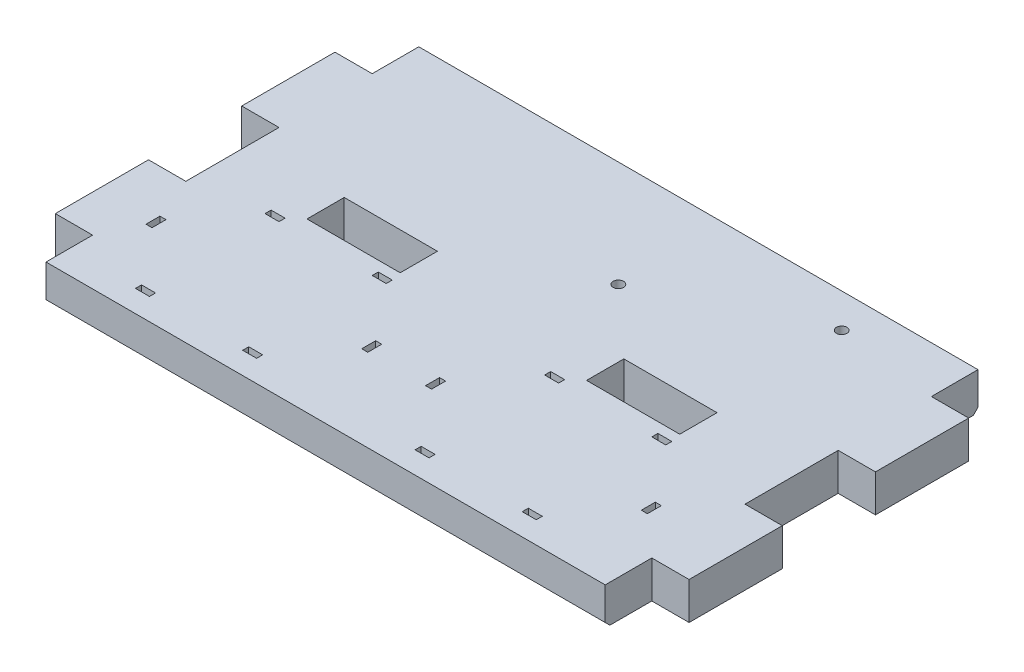
from build123d import *

# Parameters (mm, degrees)
SKETCH1_W           = 120
SKETCH1_H           = 80
SKETCH1_R           = 1.13
SKETCH1_W_2         = 3
SKETCH1_H_2         = 1.3
SKETCH1_W_3         = 1.3
SKETCH1_H_3         = 3
BOSS_EXTRUDE1_DEPTH = 8
CUT_EXTRUDE1_DEPTH  = 4
CHAMFER1_SIZE       = 1
CUT_EXTRUDE2_REACH  = 74.553
SKETCH3_W           = 20
SKETCH3_H           = 8
SKETCH4_W           = 20
SKETCH4_H           = 8
BOSS_EXTRUDE2_DEPTH = 8


with BuildPart() as part:
    # Sketch1 → Boss-Extrude1 (new body)
    with BuildSketch(Plane(origin=(0, 0, 0), x_dir=(1, 0, 0), z_dir=(0, 1, 0))):
        Rectangle(SKETCH1_W, SKETCH1_H)
        with Locations((38.07, 32.68)):
            Circle(SKETCH1_R, mode=Mode.SUBTRACT)
        with Locations((5.56, 17.26)):
            Circle(SKETCH1_R, mode=Mode.SUBTRACT)
        with Locations((16, -34.65)):
            Rectangle(SKETCH1_W_2, SKETCH1_H_2, mode=Mode.SUBTRACT)
        with Locations((16, -6.85)):
            Rectangle(SKETCH1_W_2, SKETCH1_H_2, mode=Mode.SUBTRACT)
        with Locations((39, -6.85)):
            Rectangle(SKETCH1_W_2, SKETCH1_H_2, mode=Mode.SUBTRACT)
        with Locations((39, -34.65)):
            Rectangle(SKETCH1_W_2, SKETCH1_H_2, mode=Mode.SUBTRACT)
        with Locations((50.65, -20.75)):
            Rectangle(SKETCH1_W_3, SKETCH1_H_3, mode=Mode.SUBTRACT)
        with Locations((4.35, -20.75)):
            Rectangle(SKETCH1_W_3, SKETCH1_H_3, mode=Mode.SUBTRACT)
        with Locations((-55.65, -20.75)):
            Rectangle(SKETCH1_W_3, SKETCH1_H_3, mode=Mode.SUBTRACT)
        with Locations((-9.35, -20.75)):
            Rectangle(SKETCH1_W_3, SKETCH1_H_3, mode=Mode.SUBTRACT)
        with Locations((-44, -34.65)):
            Rectangle(SKETCH1_W_2, SKETCH1_H_2, mode=Mode.SUBTRACT)
        with Locations((-44, -6.85)):
            Rectangle(SKETCH1_W_2, SKETCH1_H_2, mode=Mode.SUBTRACT)
        with Locations((-21, -34.65)):
            Rectangle(SKETCH1_W_2, SKETCH1_H_2, mode=Mode.SUBTRACT)
        with Locations((-21, -6.85)):
            Rectangle(SKETCH1_W_2, SKETCH1_H_2, mode=Mode.SUBTRACT)
    extrude(amount=BOSS_EXTRUDE1_DEPTH)

    # Sketch2 → Cut-Extrude1 (cut)
    with BuildSketch(Plane.XZ):
        Polygon((7.869401077, -17.26), (6.714700538, -15.26), (4.405299462, -15.26), (3.250598923, -17.26), (4.405299462, -19.26), (6.714700538, -19.26), align=None)
        Polygon((40.379401077, -32.68), (39.224700538, -30.68), (36.915299462, -30.68), (35.760598923, -32.68), (36.915299462, -34.68), (39.224700538, -34.68), align=None)
    extrude(amount=-CUT_EXTRUDE1_DEPTH, mode=Mode.SUBTRACT)

    # Chamfer1
    chamfer1_edges = [part.edges().sort_by_distance(p)[0] for p in [
        (0, 0, -40),
        (0, 0, 40),
    ]]
    chamfer(chamfer1_edges, length=CHAMFER1_SIZE)

    # Sketch3 → Cut-Extrude2 (cut, up to next)
    with BuildSketch(Plane.XZ, mode=Mode.PRIVATE) as cut_extrude2_sk1:
        with Locations((-30, 0)):
            Rectangle(SKETCH3_W, SKETCH3_H)
    cut_extrude2_tool1 = extrude(cut_extrude2_sk1.sketch, amount=-CUT_EXTRUDE2_REACH, mode=Mode.PRIVATE) & part.part
    cut_extrude2 = cut_extrude2_tool1.solids().sort_by_distance((-30, 0, 0))[0]
    add(cut_extrude2, mode=Mode.SUBTRACT)

    # Mirror1: Cut-Extrude2 across plane
    add(cut_extrude2.mirror(Plane.ZY), mode=Mode.SUBTRACT)

    # Sketch4 → Boss-Extrude2 (add)
    with BuildSketch(Plane.ZY.offset(60)):
        with Locations((20, 4)):
            Rectangle(SKETCH4_W, SKETCH4_H)
        with Locations((-20, 4)):
            Rectangle(SKETCH4_W, SKETCH4_H)
    boss_extrude2 = extrude(amount=BOSS_EXTRUDE2_DEPTH)

    # Mirror2: Boss-Extrude2 across plane
    add(boss_extrude2.mirror(Plane.ZY))


solid = part.part
